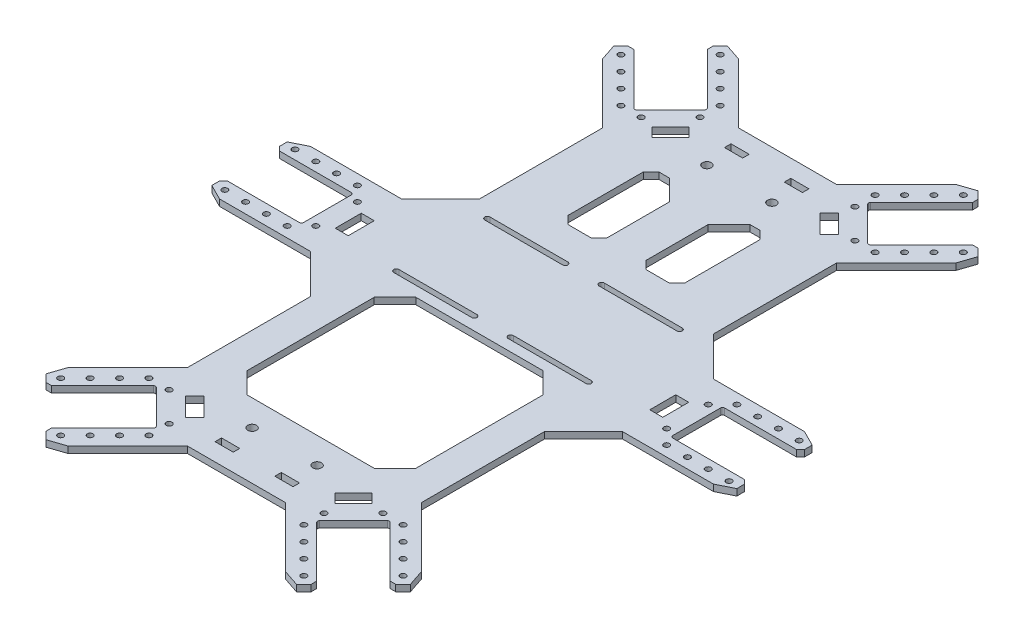
from build123d import *
from OCP.BRepFilletAPI import BRepFilletAPI_MakeChamfer

# Parameters (mm, degrees)
BOSS_EXTRU_1_DEPTH      = 2.5
ENL_V_MAT_EXTRU_1_REACH = 191.513
ESQUISSE2_W             = 24.5
ESQUISSE2_H             = 20
ESQUISSE2_W_2           = 5.5
D_GAGEMENT_M21_D        = 2.2
SYM_TRIE4_OUTLINE_R     = 1.1
SYM_TRIE4_DEPTH         = 2.5
CHANFREIN1_SIZE         = 15
CHANFREIN3_SIZE         = 1.5
CHANFREIN4_SIZE         = 6
CHANFREIN4_SIZE2        = 3
CHANFREIN5_SIZE         = 3
CHANFREIN5_SIZE2        = 6
SYM_TRIE5_DEPTH         = 2.5
SYM_TRIE6_DEPTH         = 2.5
CONG_1_R                = 0.8
ENL_V_MAT_EXTRU_2_REACH = 167.515
ESQUISSE5_W             = 5
ESQUISSE5_H             = 10
ESQUISSE5_W_2           = 7
ESQUISSE5_H_2           = 2.5
D_GAGEMENT_M31_D        = 3.4
ENL_V_MAT_EXTRU_3_REACH = 167.515


# Read off the part's stored shape, not the designer's step: Symétrie4, Symétrie5, Symétrie6
with BuildPart() as part:
    # Esquisse1 → Boss.-Extru.1 (new body)
    with BuildSketch(Plane(origin=(0, 0, 0), x_dir=(1, 0, 0), z_dir=(0, 1, 0))):
        Polygon((18.837049096, 106), (-18.837049096, 106), (-59.495863992, 146.658814896), (-85.658814896, 120.495863992), (-45, 79.837049096), (-45, 17.5), (-120, 17.5), (-120, -17.5), (-45, -17.5), (-45, -79.837049096), (-85.658814896, -120.495863992), (-59.495863992, -146.658814896), (-18.837049096, -106), (18.837049096, -106), (59.495863992, -146.658814896), (85.658814896, -120.495863992), (45, -79.837049096), (45, -17.5), (120, -17.5), (120, 17.5), (45, 17.5), (45, 79.837049096), (85.658814896, 120.495863992), (59.495863992, 146.658814896), align=None)
    extrude(amount=BOSS_EXTRU_1_DEPTH)

    # Esquisse2 → Enlèv. mat.-Extru.1 (cut, up to next)
    with BuildSketch(Plane(origin=(0, 2.5, 0), x_dir=(1, 0, 0), z_dir=(0, 1, 0)), mode=Mode.PRIVATE) as enl_v_mat_extru_1_sk1:
        Polygon((-48.182155493, 123.324291117), (-62.324291117, 109.182155493), (-45.000174977, 91.858039354), (-30.858039354, 106.000174977), align=None)
    enl_v_mat_extru_1_tool1 = extrude(enl_v_mat_extru_1_sk1.sketch, amount=-ENL_V_MAT_EXTRU_1_REACH, mode=Mode.PRIVATE) & part.part
    # Esquisse2 → Enlèv. mat.-Extru.1 (cut, up to next)
    with BuildSketch(Plane(origin=(0, 2.5, 0), x_dir=(1, 0, 0), z_dir=(0, 1, 0)), mode=Mode.PRIVATE) as enl_v_mat_extru_1_sk2:
        Polygon((-52.071242789, 127.213378413), (-66.213378413, 113.071242789), (-62.324291117, 109.182155493), (-48.182155493, 123.324291117), align=None)
    enl_v_mat_extru_1_tool2 = extrude(enl_v_mat_extru_1_sk2.sketch, amount=-ENL_V_MAT_EXTRU_1_REACH, mode=Mode.PRIVATE) & part.part
    # Esquisse2 → Enlèv. mat.-Extru.1 (cut, up to next)
    with BuildSketch(Plane(origin=(0, 2.5, 0), x_dir=(1, 0, 0), z_dir=(0, 1, 0)), mode=Mode.PRIVATE) as enl_v_mat_extru_1_sk3:
        Polygon((-52.071242789, 127.213378413), (-66.213378413, 113.071242789), (-62.324291117, 109.182155493), (-48.182155493, 123.324291117), align=None)
    enl_v_mat_extru_1_tool3 = extrude(enl_v_mat_extru_1_sk3.sketch, amount=-ENL_V_MAT_EXTRU_1_REACH, mode=Mode.PRIVATE) & part.part
    # Esquisse2 → Enlèv. mat.-Extru.1 (cut, up to next)
    with BuildSketch(Plane(origin=(0, 2.5, 0), x_dir=(1, 0, 0), z_dir=(0, 1, 0)), mode=Mode.PRIVATE) as enl_v_mat_extru_1_sk4:
        with Locations((-83.25, 0)):
            Rectangle(ESQUISSE2_W, ESQUISSE2_H)
    enl_v_mat_extru_1_tool4 = extrude(enl_v_mat_extru_1_sk4.sketch, amount=-ENL_V_MAT_EXTRU_1_REACH, mode=Mode.PRIVATE) & part.part
    # Esquisse2 → Enlèv. mat.-Extru.1 (cut, up to next)
    with BuildSketch(Plane(origin=(0, 2.5, 0), x_dir=(1, 0, 0), z_dir=(0, 1, 0)), mode=Mode.PRIVATE) as enl_v_mat_extru_1_sk5:
        with Locations((-98.25, 0)):
            Rectangle(ESQUISSE2_W_2, ESQUISSE2_H)
    enl_v_mat_extru_1_tool5 = extrude(enl_v_mat_extru_1_sk5.sketch, amount=-ENL_V_MAT_EXTRU_1_REACH, mode=Mode.PRIVATE) & part.part
    # Esquisse2 → Enlèv. mat.-Extru.1 (cut, up to next)
    with BuildSketch(Plane(origin=(0, 2.5, 0), x_dir=(1, 0, 0), z_dir=(0, 1, 0)), mode=Mode.PRIVATE) as enl_v_mat_extru_1_sk6:
        with Locations((-98.25, 0)):
            Rectangle(ESQUISSE2_W_2, ESQUISSE2_H)
    enl_v_mat_extru_1_tool6 = extrude(enl_v_mat_extru_1_sk6.sketch, amount=-ENL_V_MAT_EXTRU_1_REACH, mode=Mode.PRIVATE) & part.part
    # Esquisse2 → Enlèv. mat.-Extru.1 (cut, up to next)
    with BuildSketch(Plane(origin=(0, 2.5, 0), x_dir=(1, 0, 0), z_dir=(0, 1, 0)), mode=Mode.PRIVATE) as enl_v_mat_extru_1_sk7:
        with Locations((-98.25, 0)):
            Rectangle(ESQUISSE2_W_2, ESQUISSE2_H)
    enl_v_mat_extru_1_tool7 = extrude(enl_v_mat_extru_1_sk7.sketch, amount=-ENL_V_MAT_EXTRU_1_REACH, mode=Mode.PRIVATE) & part.part
    # Esquisse2 → Enlèv. mat.-Extru.1 (cut, up to next)
    with BuildSketch(Plane(origin=(0, 2.5, 0), x_dir=(1, 0, 0), z_dir=(0, 1, 0)), mode=Mode.PRIVATE) as enl_v_mat_extru_1_sk8:
        with Locations((-98.25, 0)):
            Rectangle(ESQUISSE2_W_2, ESQUISSE2_H)
    enl_v_mat_extru_1_tool8 = extrude(enl_v_mat_extru_1_sk8.sketch, amount=-ENL_V_MAT_EXTRU_1_REACH, mode=Mode.PRIVATE) & part.part
    # Esquisse2 → Enlèv. mat.-Extru.1 (cut, up to next)
    with BuildSketch(Plane(origin=(0, 2.5, 0), x_dir=(1, 0, 0), z_dir=(0, 1, 0)), mode=Mode.PRIVATE) as enl_v_mat_extru_1_sk9:
        Polygon((-52.071242789, 127.213378413), (-66.213378413, 113.071242789), (-62.324291117, 109.182155493), (-48.182155493, 123.324291117), align=None)
    enl_v_mat_extru_1_tool9 = extrude(enl_v_mat_extru_1_sk9.sketch, amount=-ENL_V_MAT_EXTRU_1_REACH, mode=Mode.PRIVATE) & part.part
    # Esquisse2 → Enlèv. mat.-Extru.1 (cut, up to next)
    with BuildSketch(Plane(origin=(0, 2.5, 0), x_dir=(1, 0, 0), z_dir=(0, 1, 0)), mode=Mode.PRIVATE) as enl_v_mat_extru_1_sk10:
        Polygon((-52.071242789, 127.213378413), (-66.213378413, 113.071242789), (-62.324291117, 109.182155493), (-48.182155493, 123.324291117), align=None)
    enl_v_mat_extru_1_tool10 = extrude(enl_v_mat_extru_1_sk10.sketch, amount=-ENL_V_MAT_EXTRU_1_REACH, mode=Mode.PRIVATE) & part.part
    # Esquisse2 → Enlèv. mat.-Extru.1 (cut, up to next)
    with BuildSketch(Plane(origin=(0, 2.5, 0), x_dir=(1, 0, 0), z_dir=(0, 1, 0)), mode=Mode.PRIVATE) as enl_v_mat_extru_1_sk11:
        Polygon((-101, -10), (-101, 10), (-101, 17.5), (-120, 17.5), (-120, -17.5), (-101, -17.5), align=None)
    enl_v_mat_extru_1_tool11 = extrude(enl_v_mat_extru_1_sk11.sketch, amount=-ENL_V_MAT_EXTRU_1_REACH, mode=Mode.PRIVATE) & part.part
    # Esquisse2 → Enlèv. mat.-Extru.1 (cut, up to next)
    with BuildSketch(Plane(origin=(0, 2.5, 0), x_dir=(1, 0, 0), z_dir=(0, 1, 0)), mode=Mode.PRIVATE) as enl_v_mat_extru_1_sk12:
        Polygon((-66.213378413, 113.071242789), (-52.071242789, 127.213378413), (-46.060835149, 133.223786053), (-59.495863992, 146.658814896), (-85.658814896, 120.495863992), (-72.223786053, 107.060835149), align=None)
    enl_v_mat_extru_1_tool12 = extrude(enl_v_mat_extru_1_sk12.sketch, amount=-ENL_V_MAT_EXTRU_1_REACH, mode=Mode.PRIVATE) & part.part
    enl_v_mat_extru_1_1 = enl_v_mat_extru_1_tool1.solids().sort_by_distance((-46.591165, 2.5, -107.591165))[0]
    add(enl_v_mat_extru_1_1, mode=Mode.SUBTRACT)
    enl_v_mat_extru_1_2 = enl_v_mat_extru_1_tool2.solids().sort_by_distance((-57.197767, 2.5, -118.197767))[0]
    add(enl_v_mat_extru_1_2, mode=Mode.SUBTRACT)
    enl_v_mat_extru_1_3 = enl_v_mat_extru_1_tool3.solids().sort_by_distance((-57.197767, 2.5, -118.197767))[0]
    add(enl_v_mat_extru_1_3, mode=Mode.SUBTRACT)
    enl_v_mat_extru_1_4 = enl_v_mat_extru_1_tool4.solids().sort_by_distance((-83.25, 2.5, 0))[0]
    add(enl_v_mat_extru_1_4, mode=Mode.SUBTRACT)
    enl_v_mat_extru_1_5 = enl_v_mat_extru_1_tool5.solids().sort_by_distance((-98.25, 2.5, 0))[0]
    add(enl_v_mat_extru_1_5, mode=Mode.SUBTRACT)
    enl_v_mat_extru_1_6 = enl_v_mat_extru_1_tool6.solids().sort_by_distance((-98.25, 2.5, 0))[0]
    add(enl_v_mat_extru_1_6, mode=Mode.SUBTRACT)
    enl_v_mat_extru_1_7 = enl_v_mat_extru_1_tool7.solids().sort_by_distance((-98.25, 2.5, 0))[0]
    add(enl_v_mat_extru_1_7, mode=Mode.SUBTRACT)
    enl_v_mat_extru_1_8 = enl_v_mat_extru_1_tool8.solids().sort_by_distance((-98.25, 2.5, 0))[0]
    add(enl_v_mat_extru_1_8, mode=Mode.SUBTRACT)
    enl_v_mat_extru_1_9 = enl_v_mat_extru_1_tool9.solids().sort_by_distance((-57.197767, 2.5, -118.197767))[0]
    add(enl_v_mat_extru_1_9, mode=Mode.SUBTRACT)
    enl_v_mat_extru_1_10 = enl_v_mat_extru_1_tool10.solids().sort_by_distance((-57.197767, 2.5, -118.197767))[0]
    add(enl_v_mat_extru_1_10, mode=Mode.SUBTRACT)
    enl_v_mat_extru_1_11 = enl_v_mat_extru_1_tool11.solids().sort_by_distance((-110.5, 2.5, 0))[0]
    add(enl_v_mat_extru_1_11, mode=Mode.SUBTRACT)
    enl_v_mat_extru_1_12 = enl_v_mat_extru_1_tool12.solids().sort_by_distance((-65.859825, 2.5, -126.859825))[0]
    add(enl_v_mat_extru_1_12, mode=Mode.SUBTRACT)
    enl_v_mat_extru_1 = enl_v_mat_extru_1_1 + enl_v_mat_extru_1_2 + enl_v_mat_extru_1_3 + enl_v_mat_extru_1_4 + enl_v_mat_extru_1_5 + enl_v_mat_extru_1_6 + enl_v_mat_extru_1_7 + enl_v_mat_extru_1_8 + enl_v_mat_extru_1_9 + enl_v_mat_extru_1_10 + enl_v_mat_extru_1_11 + enl_v_mat_extru_1_12  # Enlèv. mat.-Extru.1 as one shape, for the pattern or mirror that repeats it

    # Dégagement M21 (through all)
    with Locations(Plane(origin=(0, 2.5, 0), x_dir=(1, 0, 0), z_dir=(0, 1, 0))):
        with Locations((-67.5, -8), (-73, -13.5), (-81, -13.5), (-89, -13.5), (-97, -13.5), (-67.5, 8), (-73, 13.5), (-81, 13.5), (-89, 13.5), (-97, 13.5), (-41.111087681, 90.797379182), (-48.889262274, 90.797379182), (-54.546116524, 96.454233431), (-60.202970773, 102.111087681), (-65.859825023, 107.76794193), (-29.797379182, 102.111087681), (-29.797379182, 109.889262274), (-35.454233431, 115.546116524), (-41.111087681, 121.202970773), (-46.76794193, 126.859825023)):
            d_gagement_m21 = Hole(D_GAGEMENT_M21_D / 2)

    # Symétrie3: Enlèv. mat.-Extru.1, Dégagement M21 across plane
    add(enl_v_mat_extru_1.mirror(Plane(origin=(0, 0, 0), x_dir=(0, 0, 1), z_dir=(1, 0, 0))), mode=Mode.SUBTRACT)
    add(d_gagement_m21.mirror(Plane(origin=(0, 0, 0), x_dir=(0, 0, 1), z_dir=(1, 0, 0))), mode=Mode.SUBTRACT)

    # Symétrie4 outline → Symétrie4 (cut)
    with BuildSketch(Plane(origin=(0, 0, 0), x_dir=(1, 0, 0), z_dir=(0, 1, 0))):
        Polygon((30.858039354, -106.000174977), (52.071242789, -127.213378413), (46.060835149, -133.223786053), (59.495863992, -146.658814896), (85.658814896, -120.495863992), (72.223786053, -107.060835149), (66.213378413, -113.071242789), (45.000174977, -91.858039354), align=None)
        with Locations((46.76794193, -126.859825023)):
            Circle(SYM_TRIE4_OUTLINE_R)
        with Locations((41.111087681, -121.202970773)):
            Circle(SYM_TRIE4_OUTLINE_R)
        with Locations((35.454233431, -115.546116524)):
            Circle(SYM_TRIE4_OUTLINE_R)
        with Locations((29.797379182, -109.889262274)):
            Circle(SYM_TRIE4_OUTLINE_R)
        with Locations((29.797379182, -102.111087681)):
            Circle(SYM_TRIE4_OUTLINE_R)
        with Locations((65.859825023, -107.76794193)):
            Circle(SYM_TRIE4_OUTLINE_R)
        with Locations((60.202970773, -102.111087681)):
            Circle(SYM_TRIE4_OUTLINE_R)
        with Locations((54.546116524, -96.454233431)):
            Circle(SYM_TRIE4_OUTLINE_R)
        with Locations((48.889262274, -90.797379182)):
            Circle(SYM_TRIE4_OUTLINE_R)
        with Locations((41.111087681, -90.797379182)):
            Circle(SYM_TRIE4_OUTLINE_R)
        Polygon((-46.060835149, -133.223786053), (-52.071242789, -127.213378413), (-30.858039354, -106.000174977), (-45.000174977, -91.858039354), (-66.213378413, -113.071242789), (-72.223786053, -107.060835149), (-85.658814896, -120.495863992), (-59.495863992, -146.658814896), align=None)
        with Locations((-46.76794193, -126.859825023)):
            Circle(SYM_TRIE4_OUTLINE_R)
        with Locations((-41.111087681, -121.202970773)):
            Circle(SYM_TRIE4_OUTLINE_R)
        with Locations((-35.454233431, -115.546116524)):
            Circle(SYM_TRIE4_OUTLINE_R)
        with Locations((-29.797379182, -109.889262274)):
            Circle(SYM_TRIE4_OUTLINE_R)
        with Locations((-29.797379182, -102.111087681)):
            Circle(SYM_TRIE4_OUTLINE_R)
        with Locations((-65.859825023, -107.76794193)):
            Circle(SYM_TRIE4_OUTLINE_R)
        with Locations((-60.202970773, -102.111087681)):
            Circle(SYM_TRIE4_OUTLINE_R)
        with Locations((-54.546116524, -96.454233431)):
            Circle(SYM_TRIE4_OUTLINE_R)
        with Locations((-48.889262274, -90.797379182)):
            Circle(SYM_TRIE4_OUTLINE_R)
        with Locations((-41.111087681, -90.797379182)):
            Circle(SYM_TRIE4_OUTLINE_R)
    extrude(amount=SYM_TRIE4_DEPTH, mode=Mode.SUBTRACT)

    # Chanfrein1
    chanfrein1_edges = [part.edges().sort_by_distance(p)[0] for p in [
        (-45, 1.25, 17.5),
        (-45, 1.25, -17.5),
        (45, 1.25, -17.5),
        (45, 1.25, 17.5),
    ]]
    chamfer(chanfrein1_edges, length=CHANFREIN1_SIZE)

    # Chanfrein3
    chanfrein3_edges = [part.edges().sort_by_distance(p)[0] for p in [
        (-52.071242789, 1.25, -127.213378413),
        (-66.213378413, 1.25, -113.071242789),
        (-101, 1.25, 10),
        (-101, 1.25, -10),
    ]]
    chamfer(chanfrein3_edges, length=CHANFREIN3_SIZE)

    # Chanfrein4: one chamfer whose edges measure the first distance from different faces: ONE call of the kernel's chamfer builder (chamfer() names one face for all edges)
    chanfrein4_edges_1 = [part.edges().sort_by_distance(p)[0] for p in [
        (-72.223786053, 1.25, -107.060835149),
    ]]
    chanfrein4_side_1 = [part.faces().sort_by_distance(p)[0] for p in [
        (-58.611893027, 1.25, -93.448942123),
    ]]
    chanfrein4_edges_2 = [part.edges().sort_by_distance(p)[0] for p in [
        (-101, 1.25, 17.5),
    ]]
    chanfrein4_side_2 = [part.faces().sort_by_distance(p)[0] for p in [
        (-80.5, 1.25, 17.5),
    ]]
    chanfrein4 = BRepFilletAPI_MakeChamfer(part.part.solid().wrapped)
    for e in chanfrein4_edges_1:
        chanfrein4.Add(CHANFREIN4_SIZE, CHANFREIN4_SIZE2, e.wrapped, chanfrein4_side_1[0].wrapped)  # the first distance lies on this face
    for e in chanfrein4_edges_2:
        chanfrein4.Add(CHANFREIN4_SIZE, CHANFREIN4_SIZE2, e.wrapped, chanfrein4_side_2[0].wrapped)  # the first distance lies on this face
    add(Compound.cast(chanfrein4.Shape()), mode=Mode.REPLACE)

    # Chanfrein5: one chamfer whose edges measure the first distance from different faces: ONE call of the kernel's chamfer builder (chamfer() names one face for all edges)
    chanfrein5_edges_1 = [part.edges().sort_by_distance(p)[0] for p in [
        (-46.060835149, 1.25, -133.223786053),
    ]]
    chanfrein5_side_1 = [part.faces().sort_by_distance(p)[0] for p in [
        (-48.535708883, 1.25, -130.748912319),
    ]]
    chanfrein5_edges_2 = [part.edges().sort_by_distance(p)[0] for p in [
        (-101, 1.25, -17.5),
    ]]
    chanfrein5_side_2 = [part.faces().sort_by_distance(p)[0] for p in [
        (-101, 1.25, -14.5),
    ]]
    chanfrein5 = BRepFilletAPI_MakeChamfer(part.part.solid().wrapped)
    for e in chanfrein5_edges_1:
        chanfrein5.Add(CHANFREIN5_SIZE, CHANFREIN5_SIZE2, e.wrapped, chanfrein5_side_1[0].wrapped)  # the first distance lies on this face
    for e in chanfrein5_edges_2:
        chanfrein5.Add(CHANFREIN5_SIZE, CHANFREIN5_SIZE2, e.wrapped, chanfrein5_side_2[0].wrapped)  # the first distance lies on this face
    add(Compound.cast(chanfrein5.Shape()), mode=Mode.REPLACE)

    # Symétrie5 outline → Symétrie5 (cut)
    with BuildSketch(Plane(origin=(0, 0, 0), x_dir=(1, 0, 0), z_dir=(0, 1, 0))):
        Polygon((72.223786053, 107.060835149), (70.10246571, 109.182155492), (67.981145366, 102.818194462), align=None)
        Polygon((65.152718241, 112.010582618), (67.274038585, 112.010582618), (66.213378413, 113.071242789), align=None)
        Polygon((101, -10), (99.5, -10), (101, -11.5), align=None)
        Polygon((101, -17.5), (101, -14.5), (95, -17.5), align=None)
        Polygon((41.818194462, 128.981145366), (48.182155493, 131.10246571), (46.060835149, 133.223786053), align=None)
        Polygon((51.010582618, 128.274038585), (51.010582618, 126.152718241), (52.071242789, 127.213378413), align=None)
        Polygon((95, 17.5), (101, 14.5), (101, 17.5), align=None)
        Polygon((101, 11.5), (99.5, 10), (101, 10), align=None)
    extrude(amount=SYM_TRIE5_DEPTH, mode=Mode.SUBTRACT)

    # Symétrie6 outline → Symétrie6 (cut)
    with BuildSketch(Plane(origin=(0, 0, 0), x_dir=(1, 0, 0), z_dir=(0, 1, 0))):
        Polygon((-41.818194462, -128.981145366), (-48.182155493, -131.10246571), (-46.060835149, -133.223786053), align=None)
        Polygon((-51.010582618, -128.274038585), (-51.010582618, -126.152718241), (-52.071242789, -127.213378413), align=None)
        Polygon((51.010582618, -126.152718241), (51.010582618, -128.274038585), (52.071242789, -127.213378413), align=None)
        Polygon((46.060835149, -133.223786053), (48.182155493, -131.102465709), (41.818194462, -128.981145366), align=None)
        Polygon((-72.223786053, -107.060835149), (-70.10246571, -109.182155492), (-67.981145366, -102.818194462), align=None)
        Polygon((-65.152718241, -112.010582618), (-67.274038585, -112.010582618), (-66.213378413, -113.071242789), align=None)
        Polygon((67.981145366, -102.818194462), (70.10246571, -109.182155493), (72.223786053, -107.060835149), align=None)
        Polygon((67.274038585, -112.010582618), (65.152718241, -112.010582618), (66.213378413, -113.071242789), align=None)
    extrude(amount=SYM_TRIE6_DEPTH, mode=Mode.SUBTRACT)

    # Congé1
    cong_1_edges = [part.edges().sort_by_distance(p)[0] for p in [
        (-30.858039354, 1.25, -106.000174977),
        (-45.000174977, 1.25, -91.858039354),
        (71, 1.25, 10),
        (71, 1.25, -10),
        (30.858039354, 1.25, -106.000174977),
        (45.000174977, 1.25, -91.858039354),
        (30.858039354, 1.25, 106.000174977),
        (45.000174977, 1.25, 91.858039354),
        (-71, 1.25, -10),
        (-71, 1.25, 10),
        (-30.858039354, 1.25, 106.000174977),
        (-45.000174977, 1.25, 91.858039354),
    ]]
    fillet(cong_1_edges, radius=CONG_1_R)

    # Esquisse5 → Enlèv. mat.-Extru.2 (cut, up to next)
    with BuildSketch(Plane(origin=(0, 2.5, 0), x_dir=(1, 0, 0), z_dir=(0, 1, 0)), mode=Mode.PRIVATE) as enl_v_mat_extru_2_sk1:
        Polygon((-22.5, 73), (-19.5, 76), (-15.5, 76), (-7.5, 68), (-7.5, 44), (-10.5, 41), (-19.5, 41), (-22.5, 44), align=None)
    enl_v_mat_extru_2_tool1 = extrude(enl_v_mat_extru_2_sk1.sketch, amount=-ENL_V_MAT_EXTRU_2_REACH, mode=Mode.PRIVATE) & part.part
    # Esquisse5 → Enlèv. mat.-Extru.2 (cut, up to next)
    with BuildSketch(Plane(origin=(0, 2.5, 0), x_dir=(1, 0, 0), z_dir=(0, 1, 0)), mode=Mode.PRIVATE) as enl_v_mat_extru_2_sk2:
        Polygon((22.5, 73), (19.5, 76), (15.5, 76), (7.5, 68), (7.5, 44), (10.5, 41), (19.5, 41), (22.5, 44), align=None)
    enl_v_mat_extru_2_tool2 = extrude(enl_v_mat_extru_2_sk2.sketch, amount=-ENL_V_MAT_EXTRU_2_REACH, mode=Mode.PRIVATE) & part.part
    # Esquisse5 → Enlèv. mat.-Extru.2 (cut, up to next)
    with BuildSketch(Plane(origin=(0, 2.5, 0), x_dir=(1, 0, 0), z_dir=(0, 1, 0)), mode=Mode.PRIVATE) as enl_v_mat_extru_2_sk3:
        Polygon((32.5, -69.5), (24.5, -77.5), (-24.5, -77.5), (-32.5, -69.5), (-32.5, -20.5), (-24.5, -12.5), (24.5, -12.5), (32.5, -20.5), align=None)
        Polygon((-19.5, -76), (-15.5, -76), (-7.5, -68), (-7.5, -44), (-10.5, -41), (-19.5, -41), (-22.5, -44), (-22.5, -73), align=None, mode=Mode.SUBTRACT)
        Polygon((22.5, -73), (22.5, -44), (19.5, -41), (10.5, -41), (7.5, -44), (7.5, -68), (15.5, -76), (19.5, -76), align=None, mode=Mode.SUBTRACT)
    enl_v_mat_extru_2_tool3 = extrude(enl_v_mat_extru_2_sk3.sketch, amount=-ENL_V_MAT_EXTRU_2_REACH, mode=Mode.PRIVATE) & part.part
    # Esquisse5 → Enlèv. mat.-Extru.2 (cut, up to next)
    with BuildSketch(Plane(origin=(0, 2.5, 0), x_dir=(1, 0, 0), z_dir=(0, 1, 0)), mode=Mode.PRIVATE) as enl_v_mat_extru_2_sk4:
        Polygon((-22.5, -73), (-19.5, -76), (-15.5, -76), (-7.5, -68), (-7.5, -44), (-10.5, -41), (-19.5, -41), (-22.5, -44), align=None)
    enl_v_mat_extru_2_tool4 = extrude(enl_v_mat_extru_2_sk4.sketch, amount=-ENL_V_MAT_EXTRU_2_REACH, mode=Mode.PRIVATE) & part.part
    # Esquisse5 → Enlèv. mat.-Extru.2 (cut, up to next)
    with BuildSketch(Plane(origin=(0, 2.5, 0), x_dir=(1, 0, 0), z_dir=(0, 1, 0)), mode=Mode.PRIVATE) as enl_v_mat_extru_2_sk5:
        Polygon((22.5, -73), (19.5, -76), (15.5, -76), (7.5, -68), (7.5, -44), (10.5, -41), (19.5, -41), (22.5, -44), align=None)
    enl_v_mat_extru_2_tool5 = extrude(enl_v_mat_extru_2_sk5.sketch, amount=-ENL_V_MAT_EXTRU_2_REACH, mode=Mode.PRIVATE) & part.part
    # Esquisse5 → Enlèv. mat.-Extru.2 (cut, up to next)
    with BuildSketch(Plane(origin=(0, 2.5, 0), x_dir=(1, 0, 0), z_dir=(0, 1, 0)), mode=Mode.PRIVATE) as enl_v_mat_extru_2_sk6:
        with Locations((-60.5, 0)):
            Rectangle(ESQUISSE5_W, ESQUISSE5_H)
    enl_v_mat_extru_2_tool6 = extrude(enl_v_mat_extru_2_sk6.sketch, amount=-ENL_V_MAT_EXTRU_2_REACH, mode=Mode.PRIVATE) & part.part
    # Esquisse5 → Enlèv. mat.-Extru.2 (cut, up to next)
    with BuildSketch(Plane(origin=(0, 2.5, 0), x_dir=(1, 0, 0), z_dir=(0, 1, 0)), mode=Mode.PRIVATE) as enl_v_mat_extru_2_sk7:
        with Locations((60.5, 0)):
            Rectangle(ESQUISSE5_W, ESQUISSE5_H)
    enl_v_mat_extru_2_tool7 = extrude(enl_v_mat_extru_2_sk7.sketch, amount=-ENL_V_MAT_EXTRU_2_REACH, mode=Mode.PRIVATE) & part.part
    # Esquisse5 → Enlèv. mat.-Extru.2 (cut, up to next)
    with BuildSketch(Plane(origin=(0, 2.5, 0), x_dir=(1, 0, 0), z_dir=(0, 1, 0)), mode=Mode.PRIVATE) as enl_v_mat_extru_2_sk8:
        Polygon((-32.272252916, -86.201185104), (-35.807786822, -89.73671901), (-28.73671901, -96.807786822), (-25.201185104, -93.272252916), align=None)
    enl_v_mat_extru_2_tool8 = extrude(enl_v_mat_extru_2_sk8.sketch, amount=-ENL_V_MAT_EXTRU_2_REACH, mode=Mode.PRIVATE) & part.part
    # Esquisse5 → Enlèv. mat.-Extru.2 (cut, up to next)
    with BuildSketch(Plane(origin=(0, 2.5, 0), x_dir=(1, 0, 0), z_dir=(0, 1, 0)), mode=Mode.PRIVATE) as enl_v_mat_extru_2_sk9:
        Polygon((32.272252916, -86.201185104), (35.807786822, -89.73671901), (28.73671901, -96.807786822), (25.201185104, -93.272252916), align=None)
    enl_v_mat_extru_2_tool9 = extrude(enl_v_mat_extru_2_sk9.sketch, amount=-ENL_V_MAT_EXTRU_2_REACH, mode=Mode.PRIVATE) & part.part
    # Esquisse5 → Enlèv. mat.-Extru.2 (cut, up to next)
    with BuildSketch(Plane(origin=(0, 2.5, 0), x_dir=(1, 0, 0), z_dir=(0, 1, 0)), mode=Mode.PRIVATE) as enl_v_mat_extru_2_sk10:
        with Locations((11.5, -98)):
            Rectangle(ESQUISSE5_W_2, ESQUISSE5_H_2)
    enl_v_mat_extru_2_tool10 = extrude(enl_v_mat_extru_2_sk10.sketch, amount=-ENL_V_MAT_EXTRU_2_REACH, mode=Mode.PRIVATE) & part.part
    # Esquisse5 → Enlèv. mat.-Extru.2 (cut, up to next)
    with BuildSketch(Plane(origin=(0, 2.5, 0), x_dir=(1, 0, 0), z_dir=(0, 1, 0)), mode=Mode.PRIVATE) as enl_v_mat_extru_2_sk11:
        with Locations((-11.5, -98)):
            Rectangle(ESQUISSE5_W_2, ESQUISSE5_H_2)
    enl_v_mat_extru_2_tool11 = extrude(enl_v_mat_extru_2_sk11.sketch, amount=-ENL_V_MAT_EXTRU_2_REACH, mode=Mode.PRIVATE) & part.part
    # Esquisse5 → Enlèv. mat.-Extru.2 (cut, up to next)
    with BuildSketch(Plane(origin=(0, 2.5, 0), x_dir=(1, 0, 0), z_dir=(0, 1, 0)), mode=Mode.PRIVATE) as enl_v_mat_extru_2_sk12:
        with Locations((-11.5, 98)):
            Rectangle(ESQUISSE5_W_2, ESQUISSE5_H_2)
    enl_v_mat_extru_2_tool12 = extrude(enl_v_mat_extru_2_sk12.sketch, amount=-ENL_V_MAT_EXTRU_2_REACH, mode=Mode.PRIVATE) & part.part
    # Esquisse5 → Enlèv. mat.-Extru.2 (cut, up to next)
    with BuildSketch(Plane(origin=(0, 2.5, 0), x_dir=(1, 0, 0), z_dir=(0, 1, 0)), mode=Mode.PRIVATE) as enl_v_mat_extru_2_sk13:
        with Locations((11.5, 98)):
            Rectangle(ESQUISSE5_W_2, ESQUISSE5_H_2)
    enl_v_mat_extru_2_tool13 = extrude(enl_v_mat_extru_2_sk13.sketch, amount=-ENL_V_MAT_EXTRU_2_REACH, mode=Mode.PRIVATE) & part.part
    # Esquisse5 → Enlèv. mat.-Extru.2 (cut, up to next)
    with BuildSketch(Plane(origin=(0, 2.5, 0), x_dir=(1, 0, 0), z_dir=(0, 1, 0)), mode=Mode.PRIVATE) as enl_v_mat_extru_2_sk14:
        Polygon((32.272252916, 86.201185104), (35.807786822, 89.73671901), (28.73671901, 96.807786822), (25.201185104, 93.272252916), align=None)
    enl_v_mat_extru_2_tool14 = extrude(enl_v_mat_extru_2_sk14.sketch, amount=-ENL_V_MAT_EXTRU_2_REACH, mode=Mode.PRIVATE) & part.part
    # Esquisse5 → Enlèv. mat.-Extru.2 (cut, up to next)
    with BuildSketch(Plane(origin=(0, 2.5, 0), x_dir=(1, 0, 0), z_dir=(0, 1, 0)), mode=Mode.PRIVATE) as enl_v_mat_extru_2_sk15:
        Polygon((-32.272252916, 86.201185104), (-25.201185104, 93.272252916), (-28.73671901, 96.807786822), (-35.807786822, 89.73671901), align=None)
    enl_v_mat_extru_2_tool15 = extrude(enl_v_mat_extru_2_sk15.sketch, amount=-ENL_V_MAT_EXTRU_2_REACH, mode=Mode.PRIVATE) & part.part
    add(enl_v_mat_extru_2_tool1.solids().sort_by_distance((-15.261557, 2.5, -57.664929))[0], mode=Mode.SUBTRACT)
    add(enl_v_mat_extru_2_tool2.solids().sort_by_distance((15.261557, 2.5, -57.664929))[0], mode=Mode.SUBTRACT)
    add(enl_v_mat_extru_2_tool3.solids().sort_by_distance((0, 2.5, 41.129488))[0], mode=Mode.SUBTRACT)
    add(enl_v_mat_extru_2_tool4.solids().sort_by_distance((-15.261557, 2.5, 57.664929))[0], mode=Mode.SUBTRACT)
    add(enl_v_mat_extru_2_tool5.solids().sort_by_distance((15.261557, 2.5, 57.664929))[0], mode=Mode.SUBTRACT)
    add(enl_v_mat_extru_2_tool6.solids().sort_by_distance((-60.5, 2.5, 0))[0], mode=Mode.SUBTRACT)
    add(enl_v_mat_extru_2_tool7.solids().sort_by_distance((60.5, 2.5, 0))[0], mode=Mode.SUBTRACT)
    add(enl_v_mat_extru_2_tool8.solids().sort_by_distance((-30.504486, 2.5, 91.504486))[0], mode=Mode.SUBTRACT)
    add(enl_v_mat_extru_2_tool9.solids().sort_by_distance((30.504486, 2.5, 91.504486))[0], mode=Mode.SUBTRACT)
    add(enl_v_mat_extru_2_tool10.solids().sort_by_distance((11.5, 2.5, 98))[0], mode=Mode.SUBTRACT)
    add(enl_v_mat_extru_2_tool11.solids().sort_by_distance((-11.5, 2.5, 98))[0], mode=Mode.SUBTRACT)
    add(enl_v_mat_extru_2_tool12.solids().sort_by_distance((-11.5, 2.5, -98))[0], mode=Mode.SUBTRACT)
    add(enl_v_mat_extru_2_tool13.solids().sort_by_distance((11.5, 2.5, -98))[0], mode=Mode.SUBTRACT)
    add(enl_v_mat_extru_2_tool14.solids().sort_by_distance((30.504486, 2.5, -91.504486))[0], mode=Mode.SUBTRACT)
    add(enl_v_mat_extru_2_tool15.solids().sort_by_distance((-30.504486, 2.5, -91.504486))[0], mode=Mode.SUBTRACT)

    # Dégagement M31 (through all)
    with Locations(Plane(origin=(0, 2.5, 0), x_dir=(1, 0, 0), z_dir=(0, 1, 0))):
        with Locations((-12.5, 87.5), (12.5, 87.5), (12.5, -87.5), (-12.5, -87.5)):
            Hole(D_GAGEMENT_M31_D / 2)

    # Esquisse9 → Enlèv. mat.-Extru.3 (cut, up to next)
    with BuildSketch(Plane(origin=(0, 2.5, 0), x_dir=(1, 0, 0), z_dir=(0, 1, 0)), mode=Mode.PRIVATE) as enl_v_mat_extru_3_sk1:
        with BuildLine():
            Line((-37, -6.5), (-7, -6.5))
            ThreePointArc((-7, -6.5), (-6, -7.5), (-7, -8.5))
            Line((-7, -8.5), (-37, -8.5))
            ThreePointArc((-37, -8.5), (-38, -7.5), (-37, -6.5))
        make_face()
    enl_v_mat_extru_3_tool1 = extrude(enl_v_mat_extru_3_sk1.sketch, amount=-ENL_V_MAT_EXTRU_3_REACH, mode=Mode.PRIVATE) & part.part
    # Esquisse9 → Enlèv. mat.-Extru.3 (cut, up to next)
    with BuildSketch(Plane(origin=(0, 2.5, 0), x_dir=(1, 0, 0), z_dir=(0, 1, 0)), mode=Mode.PRIVATE) as enl_v_mat_extru_3_sk2:
        with BuildLine():
            Line((-37, 28.5), (-7, 28.5))
            ThreePointArc((-7, 28.5), (-6, 27.5), (-7, 26.5))
            Line((-7, 26.5), (-37, 26.5))
            ThreePointArc((-37, 26.5), (-38, 27.5), (-37, 28.5))
        make_face()
    enl_v_mat_extru_3_tool2 = extrude(enl_v_mat_extru_3_sk2.sketch, amount=-ENL_V_MAT_EXTRU_3_REACH, mode=Mode.PRIVATE) & part.part
    # Esquisse9 → Enlèv. mat.-Extru.3 (cut, up to next)
    with BuildSketch(Plane(origin=(0, 2.5, 0), x_dir=(1, 0, 0), z_dir=(0, 1, 0)), mode=Mode.PRIVATE) as enl_v_mat_extru_3_sk3:
        with BuildLine():
            Line((37, -6.5), (7, -6.5))
            ThreePointArc((7, -6.5), (6, -7.5), (7, -8.5))
            Line((7, -8.5), (37, -8.5))
            ThreePointArc((37, -8.5), (38, -7.5), (37, -6.5))
        make_face()
    enl_v_mat_extru_3_tool3 = extrude(enl_v_mat_extru_3_sk3.sketch, amount=-ENL_V_MAT_EXTRU_3_REACH, mode=Mode.PRIVATE) & part.part
    # Esquisse9 → Enlèv. mat.-Extru.3 (cut, up to next)
    with BuildSketch(Plane(origin=(0, 2.5, 0), x_dir=(1, 0, 0), z_dir=(0, 1, 0)), mode=Mode.PRIVATE) as enl_v_mat_extru_3_sk4:
        with BuildLine():
            Line((37, 28.5), (7, 28.5))
            ThreePointArc((7, 28.5), (6, 27.5), (7, 26.5))
            Line((7, 26.5), (37, 26.5))
            ThreePointArc((37, 26.5), (38, 27.5), (37, 28.5))
        make_face()
    enl_v_mat_extru_3_tool4 = extrude(enl_v_mat_extru_3_sk4.sketch, amount=-ENL_V_MAT_EXTRU_3_REACH, mode=Mode.PRIVATE) & part.part
    add(enl_v_mat_extru_3_tool1.solids().sort_by_distance((-22, 2.5, 7.5))[0], mode=Mode.SUBTRACT)
    add(enl_v_mat_extru_3_tool2.solids().sort_by_distance((-22, 2.5, -27.5))[0], mode=Mode.SUBTRACT)
    add(enl_v_mat_extru_3_tool3.solids().sort_by_distance((22, 2.5, 7.5))[0], mode=Mode.SUBTRACT)
    add(enl_v_mat_extru_3_tool4.solids().sort_by_distance((22, 2.5, -27.5))[0], mode=Mode.SUBTRACT)


solid = part.part
